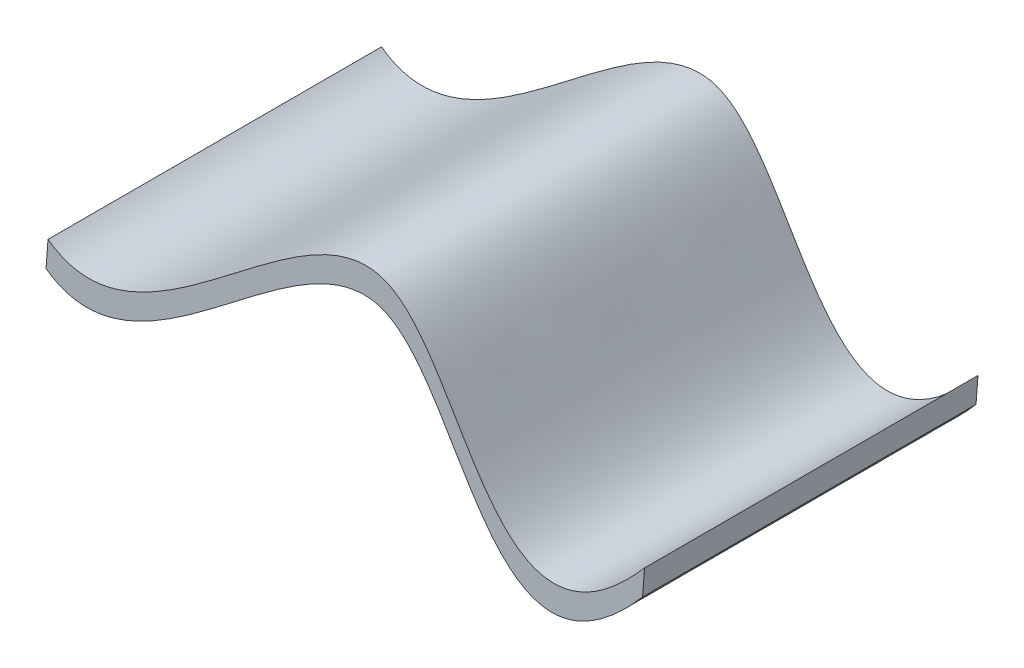
from build123d import *

# Parameters (mm, degrees)
THICKEN_START   = -63.5
THICKEN_2_DEPTH = 127


# Read off the part's stored shape, not the designer's step: 加厚2
with BuildPart() as part:
    # 加厚2 outline → 加厚2 (new body)
    with BuildSketch(Plane.XY.offset(THICKEN_START)):
        with BuildLine():
            Line((-121.008544537, 3.210085688), (-121.768485532, -6.760996985))
            add(Edge.make_bspline(
                [(-121.768485532, -6.760996985), (-85.303886584, -33.667446883), (26.659320602, 140.113783309), (48.030675933, -67.921842841), (105.395345513, -1.532830563)],
                knots=[0, 0, 0, 0, 0.511535372, 1, 1, 1, 1], degree=3))
            Line((105.395345513, -1.532830563), (106.155286508, 8.43825211))
            add(Edge.make_bspline(
                [(-121.008544537, 3.210085688), (-84.543945589, -23.69636421), (27.419261597, 150.084865983), (48.790616929, -57.950760167), (106.155286508, 8.43825211)],
                knots=[0, 0, 0, 0, 0.511535372, 1, 1, 1, 1], degree=3))
        make_face()
    extrude(amount=THICKEN_2_DEPTH)


solid = part.part
